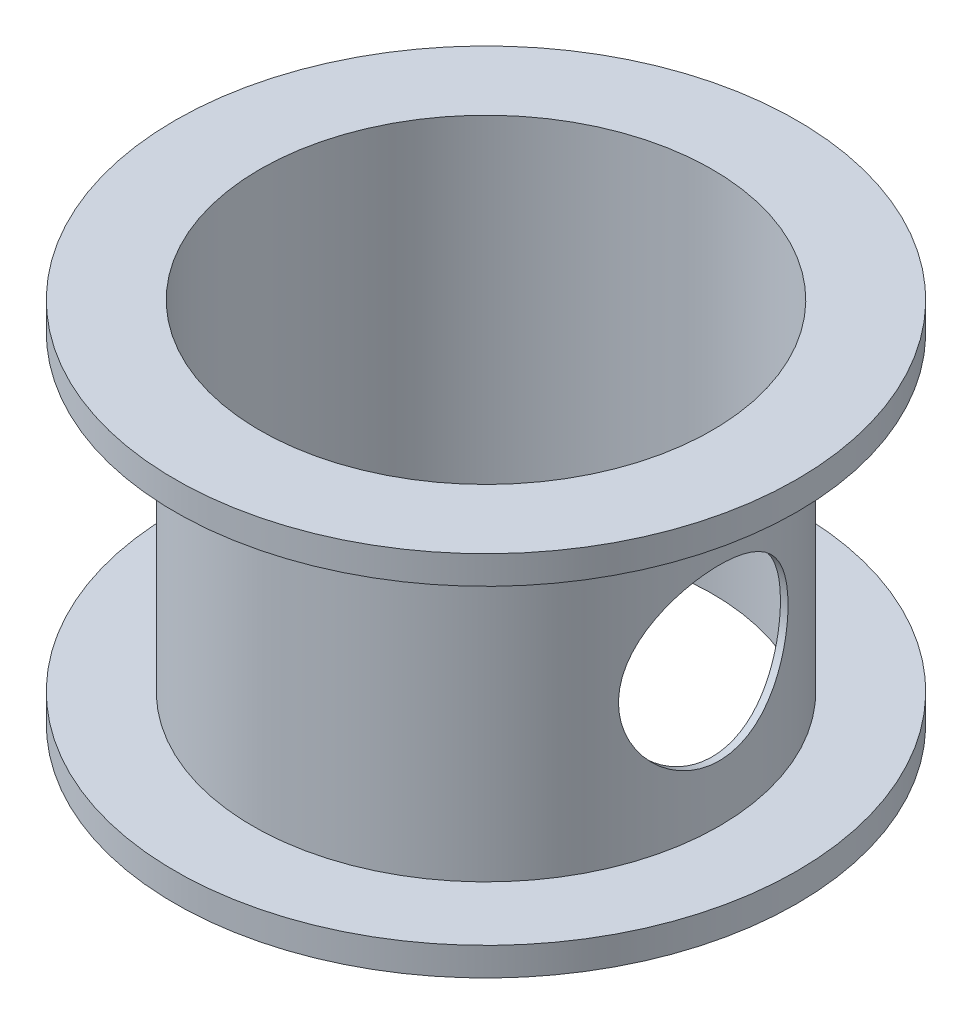
from build123d import *

# Parameters (mm, degrees)
SKETCH2_W = 39.06537918
SKETCH2_H = 38.1


with BuildPart() as part:
    # Sketch1 → Revolve1 (revolve)
    with BuildSketch(Plane.XY):
        Polygon((101.6, 1074.293), (101.6, 909.193), (139.7, 909.193), (139.7, 921.893), (104.775, 921.893), (104.775, 1061.593), (139.7, 1061.593), (139.7, 1074.293), align=None)
    revolve(axis=Axis((0, 1125.81516809, 0), (0, -1, 0)))

    # Sketch2 → Cut-Revolve2 (revolve, cut)
    with BuildSketch(Plane.XY):
        with Locations((85.24231041, 1004.443)):
            Rectangle(SKETCH2_W, SKETCH2_H)
    revolve(axis=Axis((180.975, 985.393, 0), (-1, 0, 0)), mode=Mode.SUBTRACT)


solid = part.part
